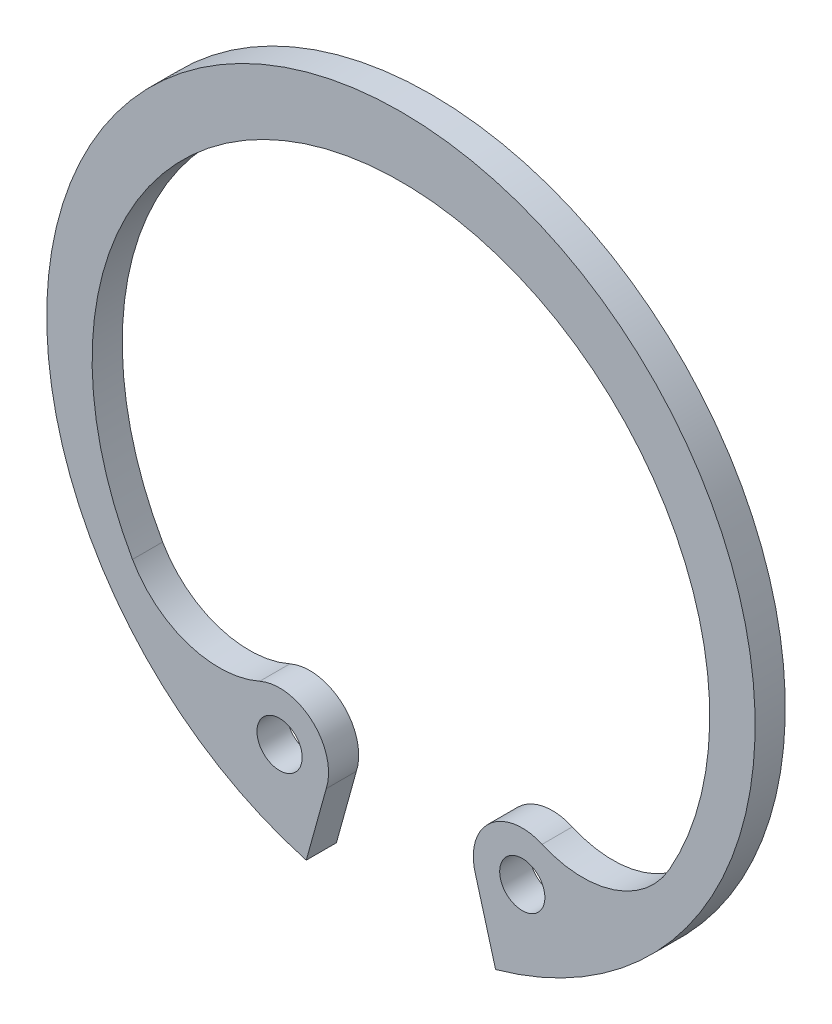
from build123d import *

# Parameters (mm, degrees)
SKETCH1_R          = 0.75
BASE_FLANGE1_DEPTH = 1


# Sheet-metal steps are written as plain solids
with BuildPart() as part:
    # Sketch1 → Base-Flange1 (new body)
    with BuildSketch(Plane.XY):
        with BuildLine():
            Line((-3.140050919, -11.322657825), (-2.47867317, -8.937806709))
            ThreePointArc((-2.47867317, -8.937806709), (-2.938495148, -7.231063808), (-4.684207754, -6.95376419))
            ThreePointArc((-4.684207754, -6.95376419), (-7.062092174, -7.07208067), (-8.90450501, -5.564152274))
            ThreePointArc((-8.90450501, -5.564152274), (0, 9.743819977), (8.90450501, -5.564152274))
            ThreePointArc((8.90450501, -5.564152274), (7.062092174, -7.07208067), (4.684207754, -6.95376419))
            ThreePointArc((4.684207754, -6.95376419), (2.938495148, -7.231063808), (2.47867317, -8.937806709))
            Line((2.47867317, -8.937806709), (3.140050919, -11.322657825))
            ThreePointArc((3.140050919, -11.322657825), (0, 11.75), (-3.140050919, -11.322657825))
        make_face()
        with Locations((-4.025278755, -8.439172409)):
            Circle(SKETCH1_R, mode=Mode.SUBTRACT)
        with Locations(Location((4.025278755, -8.439172409, 0), (0, 0, 180))):
            Circle(SKETCH1_R, mode=Mode.SUBTRACT)
    extrude(amount=-BASE_FLANGE1_DEPTH)


solid = part.part
